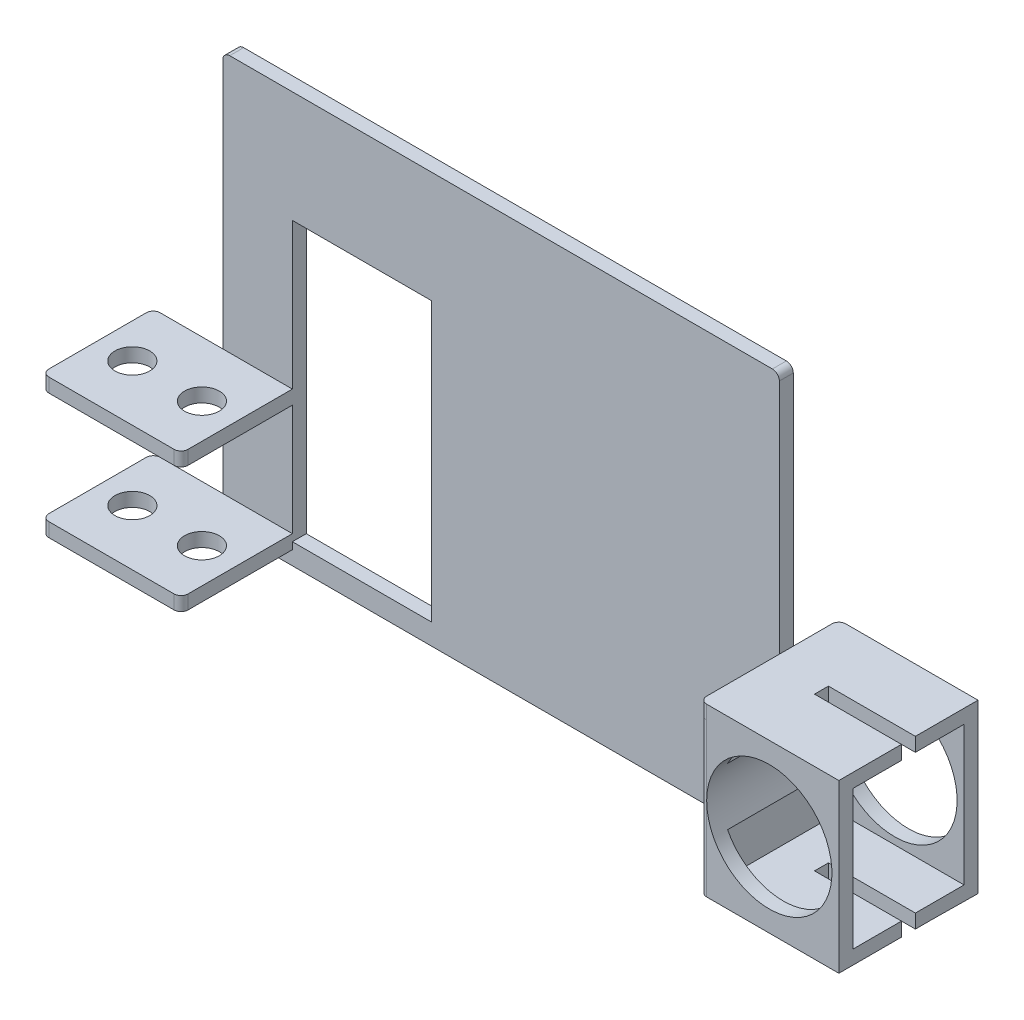
from build123d import *

# Parameters (mm, degrees)
BOSS_EXTRUDE1_DEPTH = 20
FILLET1_R           = 1
SKETCH2_R           = 9
CUT_EXTRUDE1_DEPTH  = 20
BOSS_EXTRUDE2_START = 2
BOSS_EXTRUDE2_DEPTH = 2
SKETCH4_W           = 20
SKETCH4_H           = 20
BOSS_EXTRUDE3_DEPTH = 2
FILLET2_R           = 1
SKETCH5_W           = 12.5
SKETCH5_H           = 2
CUT_EXTRUDE2_DEPTH  = 24
BOSS_EXTRUDE4_DEPTH = 80
FILLET3_R           = 1
SKETCH8_R           = 7.11392485
SKETCH8_W           = 20
SKETCH8_H           = 40
CUT_EXTRUDE3_DEPTH  = 2
SKETCH9_W           = 20
SKETCH9_H           = 2
BOSS_EXTRUDE5_DEPTH = 16
FILLET4_R           = 1
SKETCH10_R          = 2.5
CUT_EXTRUDE4_DEPTH  = 20
CUT_EXTRUDE5_DEPTH  = 1000
SKETCH16_W          = 44.924413541
SKETCH16_H          = 28.761805837
CUT_EXTRUDE6_DEPTH  = 200


with BuildPart() as part:
    # Sketch1 → Boss-Extrude1 (new body)
    with BuildSketch(Plane(origin=(0, 0, 0), x_dir=(1, 0, 0), z_dir=(0, 1, 0))):
        Polygon((-2.291666667, 11.041666667), (-22.291666667, 11.041666667), (-22.291666667, -8.958333333), (-2.291666667, -8.958333333), (-2.291666667, -6.958333333), (-20.291666667, -6.958333333), (-20.291666667, 9.041666667), (-2.291666667, 9.041666667), align=None)
    extrude(amount=BOSS_EXTRUDE1_DEPTH)

    # Fillet1
    fillet1_edges = [part.edges().sort_by_distance(p)[0] for p in [
        (-22.291666667, 10, 8.958333333),
        (-22.291666667, 10, -11.041666667),
    ]]
    fillet(fillet1_edges, radius=FILLET1_R)

    # Sketch2 → Cut-Extrude1 (cut)
    with BuildSketch(Plane.XY.offset(8.958333333)):
        with Locations(Location((-12.291666667, 10, 0), (0, 0, 180))):
            Circle(SKETCH2_R)
    extrude(amount=-CUT_EXTRUDE1_DEPTH, mode=Mode.SUBTRACT)

    # Sketch3 → Boss-Extrude2 (add)
    with BuildSketch(Plane(origin=(0, 20, 0), x_dir=(1, 0, 0), z_dir=(0, 1, 0)).offset(BOSS_EXTRUDE2_START)):
        Polygon((-2.291666667, 2.377848536), (-2.291666667, 9.041666667), (-20.291666667, 9.041666667), (-20.291666667, -6.958333333), (-2.291666667, -6.958333333), (-2.291666667, 0.377848536), align=None)
        with BuildLine():
            Line((-2.291666667, 9.041666667), (-2.291666667, 11.041666667))
            Line((-2.291666667, 11.041666667), (-21.291666667, 11.041666667))
            ThreePointArc((-21.291666667, 11.041666667), (-21.998773448, 10.748773448), (-22.291666667, 10.041666667))
            Line((-22.291666667, 10.041666667), (-22.291666667, -7.958333333))
            ThreePointArc((-22.291666667, -7.958333333), (-21.998773448, -8.665440115), (-21.291666667, -8.958333333))
            Line((-21.291666667, -8.958333333), (-2.291666667, -8.958333333))
            Line((-2.291666667, -8.958333333), (-2.291666667, -6.958333333))
            Line((-2.291666667, -6.958333333), (-20.291666667, -6.958333333))
            Line((-20.291666667, -6.958333333), (-20.291666667, 9.041666667))
            Line((-20.291666667, 9.041666667), (-2.291666667, 9.041666667))
        make_face()
    extrude(amount=-BOSS_EXTRUDE2_DEPTH)

    # Sketch4 → Boss-Extrude3 (add)
    with BuildSketch(Plane.XZ):
        with Locations((-12.291666667, -1.041666667)):
            Rectangle(SKETCH4_W, SKETCH4_H)
    extrude(amount=BOSS_EXTRUDE3_DEPTH)

    # Fillet2
    fillet2_edges = [part.edges().sort_by_distance(p)[0] for p in [
        (-22.291666667, -1, -11.041666667),
        (-22.291666667, -1, 8.958333333),
    ]]
    fillet(fillet2_edges, radius=FILLET2_R - 0.0001)  # a hair under: the kernel refuses the full size

    # Sketch5 → Cut-Extrude2 (cut)
    with BuildSketch(Plane(origin=(0, 22, 0), x_dir=(1, 0, 0), z_dir=(0, 1, 0))):
        with Locations((-8.541666667, 1.041666667)):
            Rectangle(SKETCH5_W, SKETCH5_H)
    extrude(amount=-CUT_EXTRUDE2_DEPTH, mode=Mode.SUBTRACT)

    # Sketch6 → Boss-Extrude4 (add)
    with BuildSketch(Plane.ZY.offset(22.291666667)):
        Polygon((-2.491666667, -37), (-4.491666667, -37), (-4.491666667, -2), (-4.491666667, 22), (-2.491666667, 22), (-2.491666667, -2), align=None)
    extrude(amount=BOSS_EXTRUDE4_DEPTH)

    # Fillet3
    fillet3_edges = [part.edges().sort_by_distance(p)[0] for p in [
        (-22.291666667, -37, -3.491666667),
        (-102.291666667, 22, -3.491666667),
        (-102.291666667, -37, -3.491666667),
    ]]
    fillet(fillet3_edges, radius=FILLET3_R)

    # Sketch8 → Cut-Extrude3 (cut)
    with BuildSketch(Plane(origin=(0, 0, -4.491666667), x_dir=(-1, 0, 0), z_dir=(0, 0, -1))):
        with Locations((12.291666667, 10)):
            Circle(SKETCH8_R)
        with Locations((82.291666667, -1)):
            Rectangle(SKETCH8_W, SKETCH8_H)
    extrude(amount=-CUT_EXTRUDE3_DEPTH, mode=Mode.SUBTRACT)

    # Sketch9 → Boss-Extrude5 (add)
    with BuildSketch(Plane.XY.offset(-2.491666667)):
        Polygon((-92.823958121, 20), (-112.291666667, 20), (-112.291666667, 18), (-92.291666667, 18), (-92.291666667, 20), align=None)
        with Locations((-102.291666667, 1)):
            Rectangle(SKETCH9_W, SKETCH9_H)
    extrude(amount=BOSS_EXTRUDE5_DEPTH)

    # Fillet4
    fillet4_edges = [part.edges().sort_by_distance(p)[0] for p in [
        (-112.291666667, 19, -2.491666667),
        (-112.291666667, 19, 13.508333333),
        (-92.291666667, 19, 13.508333333),
        (-112.291666667, 1, -2.491666667),
        (-92.291666667, 1, 13.508333333),
        (-112.291666667, 1, 13.508333333),
    ]]
    fillet(fillet4_edges, radius=FILLET4_R)

    # Sketch10 → Cut-Extrude4 (cut)
    with BuildSketch(Plane(origin=(0, 20, 0), x_dir=(1, 0, 0), z_dir=(0, 1, 0))):
        with Locations(Location((-97.291666667, -5.508333333, 0), (0, 0, 180))):
            Circle(SKETCH10_R)
        with Locations(Location((-107.291666667, -5.508333333, 0), (0, 0, 180))):
            Circle(SKETCH10_R)
    extrude(amount=-CUT_EXTRUDE4_DEPTH, mode=Mode.SUBTRACT)

    # Mirror18: part across plane


with BuildPart() as part_1:
    add(part.part)
    add(part.part.mirror(Plane.ZX.offset(22)))

    # Sketch15 → Cut-Extrude5 (cut)
    with BuildSketch(Plane.ZY.offset(102.291666667)):
        Polygon((-4.491666667, 22), (26.371176894, 22), (26.371176894, -60.225143759), (-46.701352218, -60.225143759), (-46.701352218, 21.5), align=None)
    extrude(amount=-CUT_EXTRUDE5_DEPTH, mode=Mode.SUBTRACT)


with BuildPart() as cut_extrude5_piece_1:
    # of the separate pieces the step leaves, piece 1, a body of its own (cut_extrude5_pieces)
    add(part_1.part.solids().sort_by_distance((-101.291666667, 22, -2.491666667))[0])


with BuildPart() as cut_extrude5_piece_2:
    # of the separate pieces the step leaves, piece 2, a body of its own (cut_extrude5_pieces)
    add(part_1.part.solids().sort_by_distance((-112.291666667, 20, -1.491666667))[0])


with BuildPart() as cut_extrude5_piece_3:
    # of the separate pieces the step leaves, piece 3, a body of its own (cut_extrude5_pieces)
    add(part_1.part.solids().sort_by_distance((-111.291666667, 2, -2.491666667))[0])


with BuildPart() as cut_extrude6_tool:
    # Sketch16 → Cut-Extrude6 (new body)
    with BuildSketch(Plane(origin=(-102.291666667, 0, 0), x_dir=(0, 0, -1), z_dir=(1, 0, 0))):
        with Locations((-5.305801417, 7.602093766)):
            Rectangle(SKETCH16_W, SKETCH16_H)
    extrude(amount=-CUT_EXTRUDE6_DEPTH)


with BuildPart() as cut_extrude5_piece_2_1:
    add(cut_extrude5_piece_2.part)

    # Cut-Extrude6: cut by cut_extrude6_tool
    add(cut_extrude6_tool.part, mode=Mode.SUBTRACT)


with BuildPart() as cut_extrude5_piece_3_1:
    add(cut_extrude5_piece_3.part)

    # Cut-Extrude6: cut by cut_extrude6_tool
    add(cut_extrude6_tool.part, mode=Mode.SUBTRACT)


solid = cut_extrude5_piece_1.part
